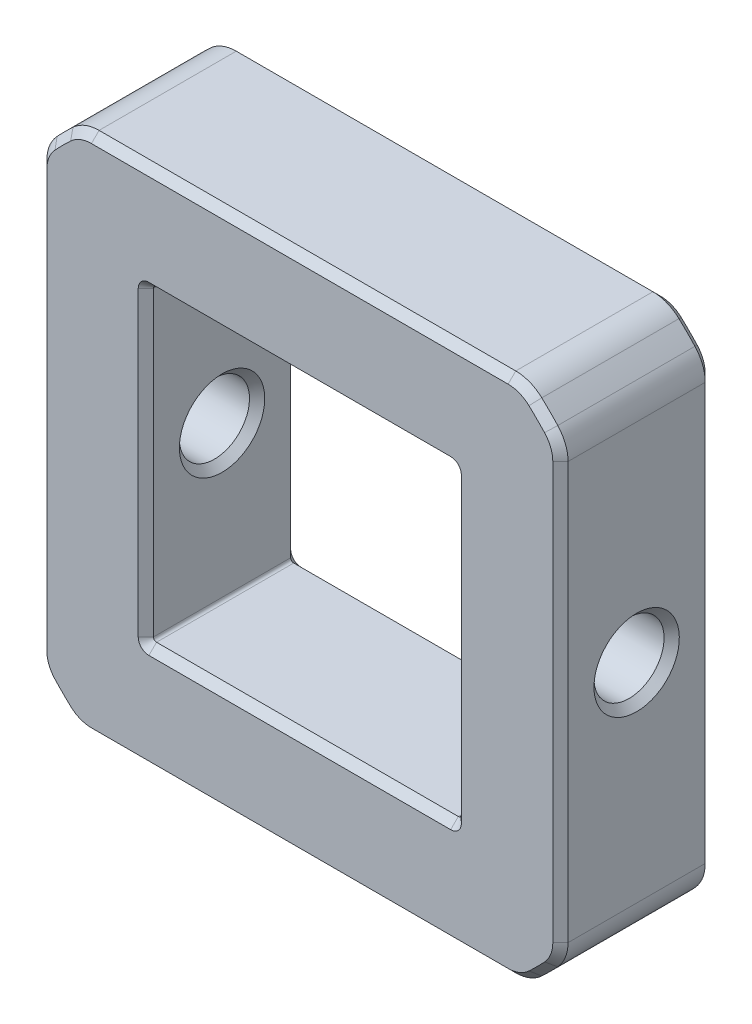
from build123d import *

# Parameters (mm, degrees)
SKIZZE1_W                       = 20.2
SKIZZE1_H                       = 20.2
AUFSATZ_LINEAR_AUSTRAGEN1_DEPTH = 10
VERRUNDUNG1_R                   = 0.2
VERRUNDUNG2_R                   = 2.5
SKIZZE2_R                       = 2.3
SCHNITT_LINEAR_AUSTRAGEN1_DEPTH = 40.522778242
FASE2_SIZE                      = 0.5


with BuildPart() as part:
    # Skizze1 → Aufsatz-Linear austragen1 (new body)
    with BuildSketch(Plane.XY):
        with BuildLine():
            Line((14.623269128, 17.1), (-14.623269128, 17.1))
            ThreePointArc((-14.623269128, 17.1), (-15.909902577, 15.909902577), (-17.1, 14.623269128))
            Line((-17.1, 14.623269128), (-17.1, -14.623269128))
            ThreePointArc((-17.1, -14.623269128), (-15.909902577, -15.909902577), (-14.623269128, -17.1))
            Line((-14.623269128, -17.1), (14.623269128, -17.1))
            ThreePointArc((14.623269128, -17.1), (15.909902577, -15.909902577), (17.1, -14.623269128))
            Line((17.1, -14.623269128), (17.1, 14.623269128))
            ThreePointArc((17.1, 14.623269128), (15.909902577, 15.909902577), (14.623269128, 17.1))
        make_face()
        Rectangle(SKIZZE1_W, SKIZZE1_H, mode=Mode.SUBTRACT)
    extrude(amount=AUFSATZ_LINEAR_AUSTRAGEN1_DEPTH)

    # Verrundung1
    verrundung1_edges = [part.edges().sort_by_distance(p)[0] for p in [
        (10.1, -10.1, 5),
        (-10.1, -10.1, 5),
        (-10.1, 10.1, 5),
        (10.1, 10.1, 5),
    ]]
    fillet(verrundung1_edges, radius=VERRUNDUNG1_R)

    # Verrundung2
    verrundung2_edges = [part.edges().sort_by_distance(p)[0] for p in [
        (14.623269128, 17.1, 5),
        (17.1, 14.623269128, 5),
        (17.1, -14.623269128, 5),
        (14.623269128, -17.1, 5),
        (-14.623269128, -17.1, 5),
        (-17.1, -14.623269128, 5),
        (-17.1, 14.623269128, 5),
        (-14.623269128, 17.1, 5),
    ]]
    fillet(verrundung2_edges, radius=VERRUNDUNG2_R)

    # Skizze2 → Schnitt-Linear austragen1 (cut, through all)
    with BuildSketch(Plane(origin=(17.1, 0, 0), x_dir=(0, 0, -1), z_dir=(1, 0, 0))):
        with Locations((-5, 0)):
            Circle(SKIZZE2_R)
    extrude(amount=-SCHNITT_LINEAR_AUSTRAGEN1_DEPTH, mode=Mode.SUBTRACT)

    # Fase2
    fase2_edges = [part.edges().sort_by_distance(p)[0] for p in [
        (17.1, 0, 7.3),
        (10.1, 0, 7.3),
        (-17.1, 0, 7.3),
        (-10.1, 0, 7.3),
        (-10.041421356, 10.041421356, 10),
        (-10.1, 0, 10),
        (-10.041421356, -10.041421356, 10),
        (0, -10.1, 10),
        (10.041421356, -10.041421356, 10),
        (10.1, 0, 10),
        (10.041421356, 10.041421356, 10),
        (0, 10.1, 10),
        (16.925134405, 14.587501553, 10),
        (17.1, 0, 10),
        (16.925134405, -14.587501553, 10),
        (15.909902577, -15.909902577, 10),
        (14.587501553, -16.925134405, 10),
        (0, -17.1, 10),
        (-14.587501553, -16.925134405, 10),
        (-15.909902577, -15.909902577, 10),
        (-16.925134405, -14.587501553, 10),
        (-17.1, 0, 10),
        (-16.925134405, 14.587501553, 10),
        (-15.909902577, 15.909902577, 10),
        (-14.587501553, 16.925134405, 10),
        (0, 17.1, 10),
        (14.587501553, 16.925134405, 10),
        (15.909902577, 15.909902577, 10),
        (-10.041421356, -10.041421356, 0),
        (-10.1, 0, 0),
        (-10.041421356, 10.041421356, 0),
        (0, 10.1, 0),
        (10.041421356, 10.041421356, 0),
        (10.1, 0, 0),
        (10.041421356, -10.041421356, 0),
        (0, -10.1, 0),
        (-14.587501553, 16.925134405, 0),
        (-15.909902577, 15.909902577, 0),
        (-16.925134405, 14.587501553, 0),
        (-17.1, 0, 0),
        (-16.925134405, -14.587501553, 0),
        (-15.909902577, -15.909902577, 0),
        (-14.587501553, -16.925134405, 0),
        (0, -17.1, 0),
        (14.587501553, -16.925134405, 0),
        (15.909902577, -15.909902577, 0),
        (16.925134405, -14.587501553, 0),
        (17.1, 0, 0),
        (16.925134405, 14.587501553, 0),
        (15.909902577, 15.909902577, 0),
        (14.587501553, 16.925134405, 0),
        (0, 17.1, 0),
    ]]
    chamfer(fase2_edges, length=FASE2_SIZE)


solid = part.part
